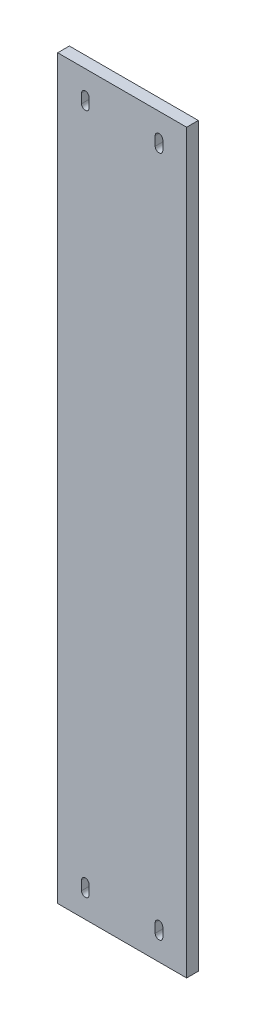
from build123d import *

# Parameters (mm, degrees)
SKETCH1_W           = 70
SKETCH1_H           = 400
BOSS_EXTRUDE1_DEPTH = 6.35


with BuildPart() as part:
    # Sketch1 → Boss-Extrude1 (new body)
    with BuildSketch(Plane.XY):
        Rectangle(SKETCH1_W, SKETCH1_H)
        with BuildLine():
            Line((-22.05, 182.5), (-22.05, 187.5))
            ThreePointArc((-22.05, 187.5), (-20, 189.55), (-17.95, 187.5))
            Line((-17.95, 187.5), (-17.95, 182.5))
            ThreePointArc((-17.95, 182.5), (-20, 180.45), (-22.05, 182.5))
        make_face(mode=Mode.SUBTRACT)
        with BuildLine():
            Line((22.05, 182.5), (22.05, 187.5))
            ThreePointArc((22.05, 187.5), (20, 189.55), (17.95, 187.5))
            Line((17.95, 187.5), (17.95, 182.5))
            ThreePointArc((17.95, 182.5), (20, 180.45), (22.05, 182.5))
        make_face(mode=Mode.SUBTRACT)
        with BuildLine():
            Line((-22.05, -182.5), (-22.05, -187.5))
            ThreePointArc((-22.05, -187.5), (-20, -189.55), (-17.95, -187.5))
            Line((-17.95, -187.5), (-17.95, -182.5))
            ThreePointArc((-17.95, -182.5), (-20, -180.45), (-22.05, -182.5))
        make_face(mode=Mode.SUBTRACT)
        with BuildLine():
            Line((22.05, -182.5), (22.05, -187.5))
            ThreePointArc((22.05, -187.5), (20, -189.55), (17.95, -187.5))
            Line((17.95, -187.5), (17.95, -182.5))
            ThreePointArc((17.95, -182.5), (20, -180.45), (22.05, -182.5))
        make_face(mode=Mode.SUBTRACT)
    extrude(amount=BOSS_EXTRUDE1_DEPTH)


solid = part.part
